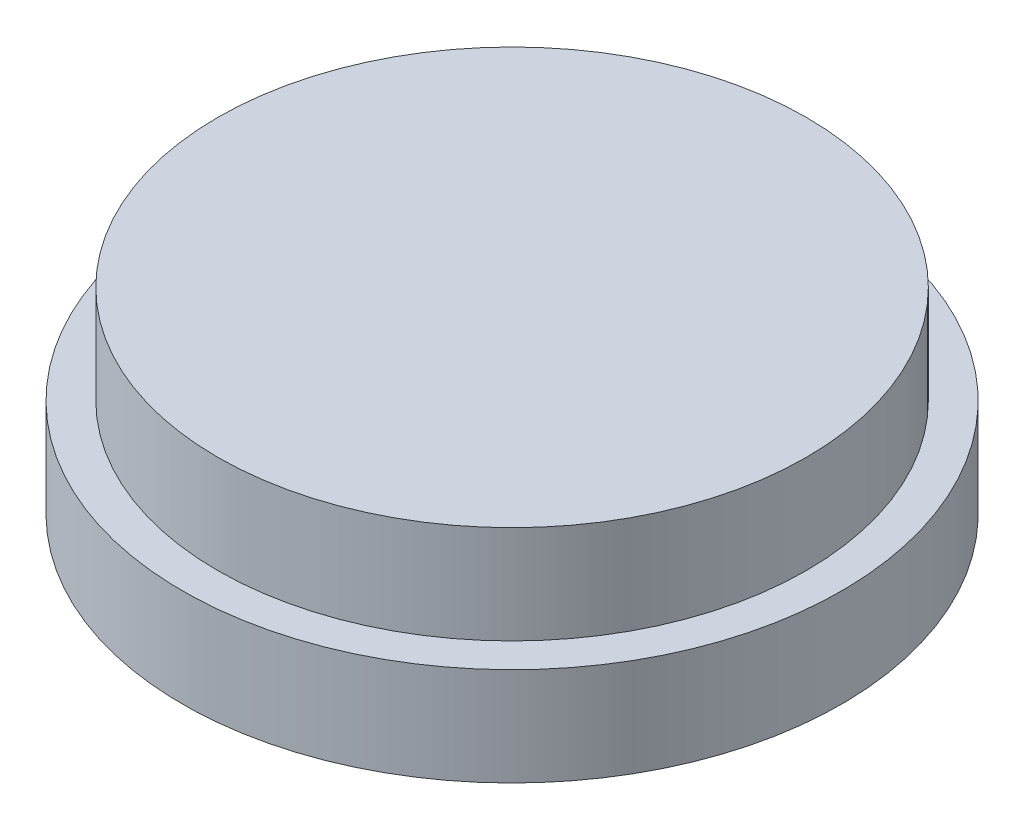
from build123d import *

# Parameters (mm, degrees)
SKETCH1_R           = 30
BOSS_EXTRUDE1_DEPTH = 10
SKETCH2_R           = 33.588527639
SKETCH2_R_2         = 27.5
BOSS_EXTRUDE2_DEPTH = 10


with BuildPart() as part:
    # Sketch1 → Boss-Extrude1 (new body)
    with BuildSketch(Plane(origin=(0, 0, 0), x_dir=(1, 0, 0), z_dir=(0, 1, 0))):
        Circle(SKETCH1_R)
    extrude(amount=BOSS_EXTRUDE1_DEPTH)

    # Sketch2 → Boss-Extrude2 (add)
    with BuildSketch(Plane(origin=(0, 0, 0), x_dir=(-1, 0, 0), z_dir=(0, -1, 0))):
        Circle(SKETCH2_R)
        Circle(SKETCH2_R_2, mode=Mode.SUBTRACT)
    extrude(amount=BOSS_EXTRUDE2_DEPTH)


with BuildPart() as body_2:
    # Split1: the piece on the far side of the plane
    add(part.part)
    split(bisect_by=Plane.ZX, keep=Keep.BOTTOM)


with BuildPart() as part_1:
    add(part.part)

    # Split1
    split(bisect_by=Plane.ZX, keep=Keep.TOP)


solid = Compound([body_2.part, part_1.part])
